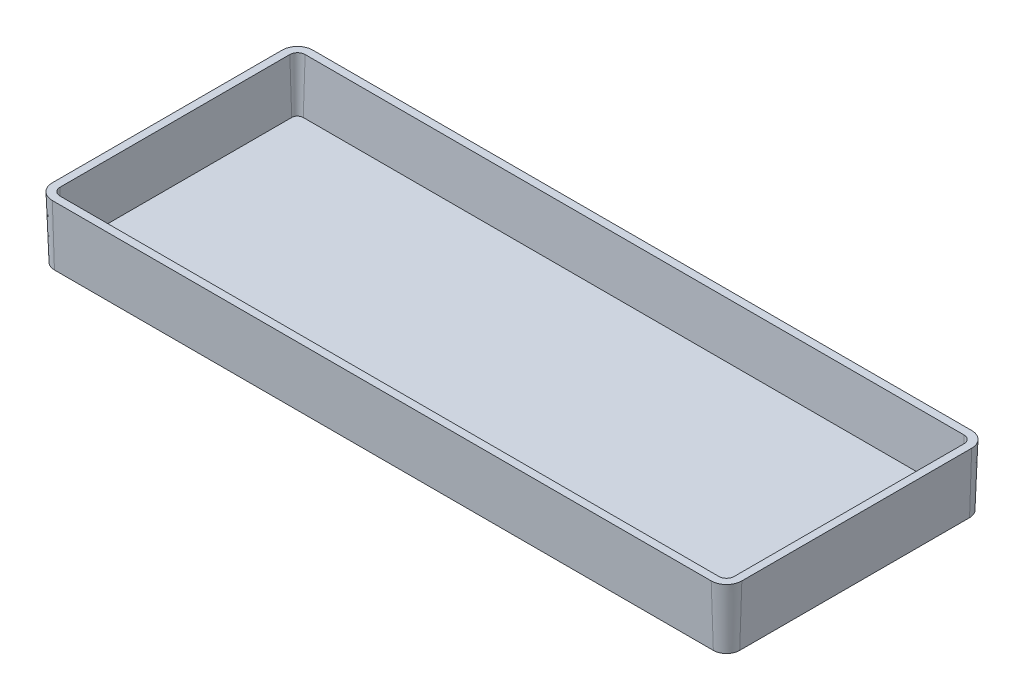
from build123d import *

# Parameters (mm, degrees)
BOSS_EXTRUDE1_DEPTH = 4
BOSS_EXTRUDE1_DRAFT = -2
SHELL1_T            = -0.5


with BuildPart() as part:
    # Sketch1 → Boss-Extrude1 (with draft: the straight prism first)
    with BuildSketch(Plane(origin=(0, 0, 0), x_dir=(1, 0, 0), z_dir=(0, 1, 0))):
        with BuildLine():
            Line((-21.5, -8.5), (21.5, -8.5))
            ThreePointArc((21.5, -8.5), (22.207106781, -8.207106781), (22.5, -7.5))
            Line((22.5, -7.5), (22.5, 7.5))
            ThreePointArc((22.5, 7.5), (22.207106781, 8.207106781), (21.5, 8.5))
            Line((21.5, 8.5), (-21.5, 8.5))
            ThreePointArc((-21.5, 8.5), (-22.207106781, 8.207106781), (-22.5, 7.5))
            Line((-22.5, 7.5), (-22.5, -7.5))
            ThreePointArc((-22.5, -7.5), (-22.207106781, -8.207106781), (-21.5, -8.5))
        make_face()
    extrude(amount=-BOSS_EXTRUDE1_DEPTH)
    # Boss-Extrude1: the draft: its side faces are tilted about the plane it starts from
    boss_extrude1_sides = [part.faces().sort_by_distance(p)[0] for p in [
        (0, -2, 8.5),
        (22.207106781, -2, 8.207106781),
        (22.5, -2, 0),
        (22.207106781, -2, -8.207106781),
        (0, -2, -8.5),
        (-22.207106781, -2, -8.207106781),
        (-22.5, -2, 0),
        (-22.207106781, -2, 8.207106781),
    ]]
    draft(boss_extrude1_sides, Plane(origin=(0, 0, 0), x_dir=(1, 0, 0), z_dir=(0, 1, 0)), BOSS_EXTRUDE1_DRAFT)

    # Shell1
    shell1_openings = [part.faces().sort_by_distance(p)[0] for p in [
        (0, 0, 0),
    ]]
    offset(amount=SHELL1_T, openings=shell1_openings, kind=Kind.INTERSECTION)


solid = part.part
